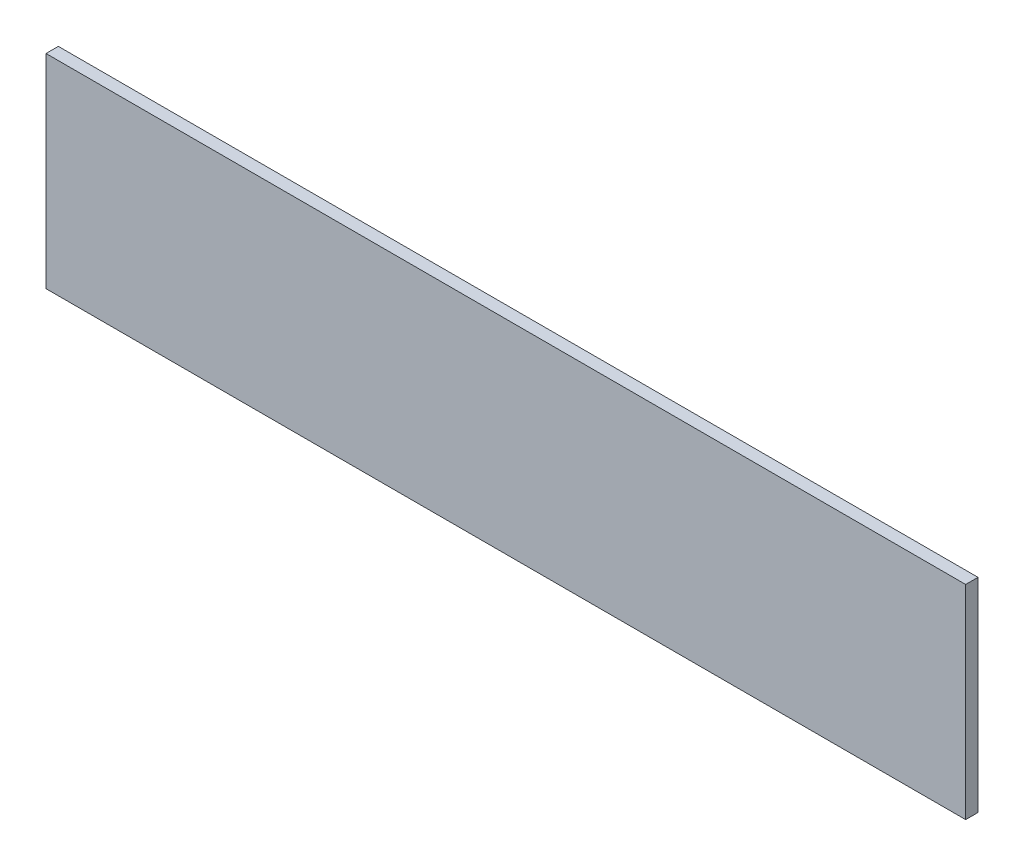
from build123d import *

# Parameters (mm, degrees)
SKETCH1_W           = 149
SKETCH1_H           = 33
BOSS_EXTRUDE1_DEPTH = 2


with BuildPart() as part:
    # Sketch1 → Boss-Extrude1 (new body)
    with BuildSketch(Plane.XY):
        Rectangle(SKETCH1_W, SKETCH1_H)
    extrude(amount=BOSS_EXTRUDE1_DEPTH)


solid = part.part
